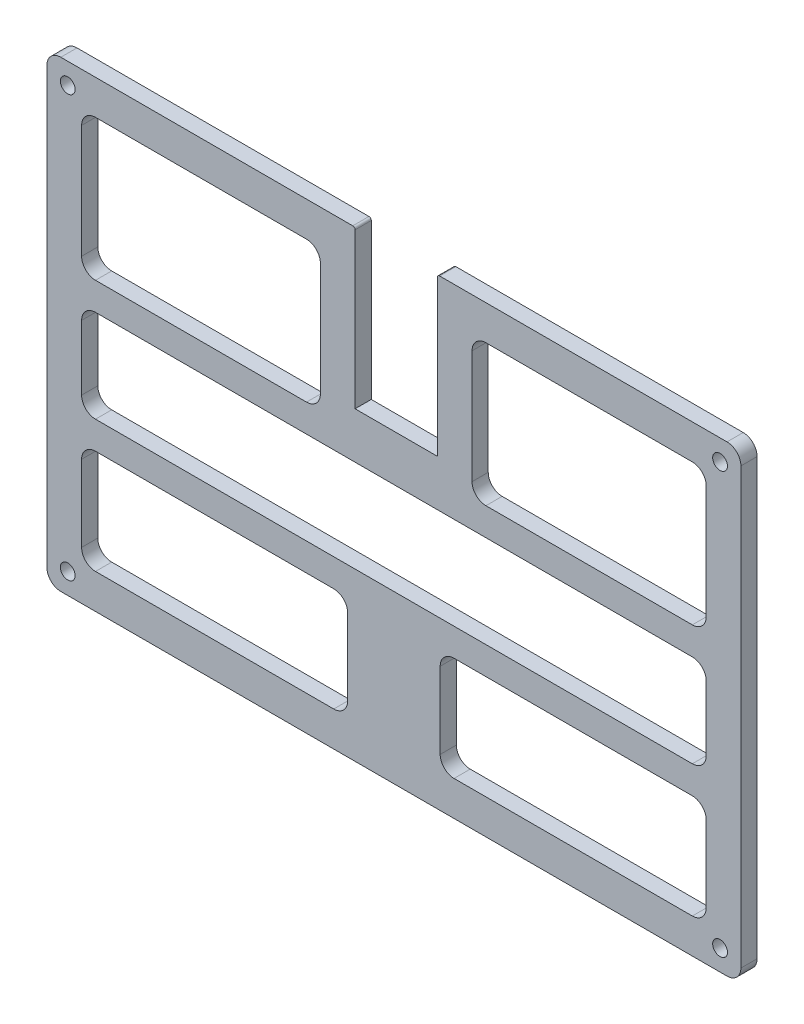
from build123d import *

# Parameters (mm, degrees)
MODEL_R         = 1.59999954
EXTRUDE_1_DEPTH = 3.5
SKETCH_2_W      = 135.00000272
SKETCH_2_H      = 6
EXTRUDE_2_DEPTH = 3.5
FILLET_2_R      = 3
FILLET_3_R      = 3
FILLET_4_R      = 3
FILLET_5_R      = 3
FILLET_6_R      = 3
FILLET_7_R      = 3
FILLET_8_R      = 3
FILLET_9_R      = 3
FILLET_10_R     = 3
FILLET_11_R     = 3
FILLET_12_DEPTH = 3.5
FILLET_13_R     = 3
FILLET_14_R     = 3
FILLET_15_DEPTH = 3.5
FILLET_16_R     = 3
FILLET_17_R     = 3
SHELL_5_DEPTH   = 1.55


with BuildPart() as part:
    # Model → 凸台-拉伸1 (new body)
    with BuildSketch(Plane.XY):
        with BuildLine():
            Line((84.889976, 100), (147.00000318, 100))
            ThreePointArc((147.00000318, 100), (149.121322873, 99.121320613), (150.00000226, 97.00000092))
            Line((150.00000226, 97.00000092), (150.00000226, 3.00000162))
            ThreePointArc((150.00000226, 3.00000162), (149.121322873, 0.878681927), (147.00000318, 2.54e-06))
            Line((147.00000318, 2.54e-06), (2.99999908, 2.54e-06))
            ThreePointArc((2.99999908, 2.54e-06), (0.878679387, 0.878681927), (0, 3.00000162))
            Line((0, 3.00000162), (0, 97.00000092))
            ThreePointArc((0, 97.00000092), (0.878679387, 99.121320613), (2.99999908, 100))
            Line((2.99999908, 100), (66.109976, 100))
            ThreePointArc((66.109976, 100), (66.463529391, 99.853553391), (66.609976, 99.5))
            Line((66.609976, 99.5), (66.609976, 66))
            Line((66.609976, 66), (84.389976, 66))
            Line((84.389976, 66), (84.389976, 99.5))
            ThreePointArc((84.389976, 99.5), (84.536422609, 99.853553391), (84.889976, 100))
        make_face()
        with Locations((4.49999862, 95.50000204)):
            Circle(MODEL_R, mode=Mode.SUBTRACT)
        with Locations((145.5000138, 95.50001474)):
            Circle(MODEL_R, mode=Mode.SUBTRACT)
        with Locations((145.5000138, 4.49999608)):
            Circle(MODEL_R, mode=Mode.SUBTRACT)
        with Locations((4.49999354, 4.49999608)):
            Circle(MODEL_R, mode=Mode.SUBTRACT)
        with BuildLine():
            Line((59.609976, 58.5), (91.389976, 58.5))
            ThreePointArc((91.389976, 58.5), (91.743529391, 58.646446609), (91.889976, 59))
            Line((91.889976, 59), (91.889976, 92.00000066))
            ThreePointArc((91.889976, 92.00000066), (92.036422609, 92.353554051), (92.389976, 92.50000066))
            Line((92.389976, 92.50000066), (139.50000364, 92.50000066))
            ThreePointArc((139.50000364, 92.50000066), (141.621323333, 91.621321273), (142.50000272, 89.50000158))
            Line((142.50000272, 89.50000158), (142.50000272, 10.49999608))
            ThreePointArc((142.50000272, 10.49999608), (141.621323333, 8.378676387), (139.50000364, 7.499997))
            Line((139.50000364, 7.499997), (10.49999908, 7.499997))
            ThreePointArc((10.49999908, 7.499997), (8.378679387, 8.378676387), (7.5, 10.49999608))
            Line((7.5, 10.49999608), (7.5, 89.50000158))
            ThreePointArc((7.5, 89.50000158), (8.378679387, 91.621321273), (10.49999908, 92.50000066))
            Line((10.49999908, 92.50000066), (58.609976, 92.50000066))
            ThreePointArc((58.609976, 92.50000066), (58.963529391, 92.353554051), (59.109976, 92.00000066))
            Line((59.109976, 92.00000066), (59.109976, 59))
            ThreePointArc((59.109976, 59), (59.256422609, 58.646446609), (59.609976, 58.5))
        make_face(mode=Mode.SUBTRACT)
    extrude(amount=EXTRUDE_1_DEPTH)

    # 草图2 → 凸台-拉伸2 (add)
    with BuildSketch(Plane(origin=(0, 0, 0), x_dir=(-1, 0, 0), z_dir=(0, 0, -1))):
        with Locations((-75.00000136, 58.9994)):
            Rectangle(SKETCH_2_W, SKETCH_2_H)
        Polygon((-7.5, 30.00002482), (-65.0000272, 30.00002482), (-65.0000272, 7.499997), (-71.0000272, 7.499997), (-79.0000068, 7.499997), (-85.0000068, 7.499997), (-85.0000068, 30.00002482), (-142.50000272, 30.00002482), (-142.50000272, 36), (-7.5, 36), align=None)
    extrude(amount=-EXTRUDE_2_DEPTH)

    # 圆角2
    fillet_2_edges = [part.edges().sort_by_distance(p)[0] for p in [
        (142.50000272, 30.00002482, 1.75),
    ]]
    fillet(fillet_2_edges, radius=FILLET_2_R)

    # 圆角3
    fillet_3_edges = [part.edges().sort_by_distance(p)[0] for p in [
        (85.0000068, 30.00002482, 1.75),
    ]]
    fillet(fillet_3_edges, radius=FILLET_3_R)

    # 圆角4
    fillet_4_edges = [part.edges().sort_by_distance(p)[0] for p in [
        (85.0000068, 7.499997, 1.75),
    ]]
    fillet(fillet_4_edges, radius=FILLET_4_R)

    # 圆角5
    fillet_5_edges = [part.edges().sort_by_distance(p)[0] for p in [
        (65.0000272, 30.00002482, 1.75),
    ]]
    fillet(fillet_5_edges, radius=FILLET_5_R)

    # 圆角6
    fillet_6_edges = [part.edges().sort_by_distance(p)[0] for p in [
        (7.5, 30.00002482, 1.75),
    ]]
    fillet(fillet_6_edges, radius=FILLET_6_R)

    # 圆角7
    fillet_7_edges = [part.edges().sort_by_distance(p)[0] for p in [
        (65.0000272, 7.499997, 1.75),
    ]]
    fillet(fillet_7_edges, radius=FILLET_7_R)

    # 圆角8
    fillet_8_edges = [part.edges().sort_by_distance(p)[0] for p in [
        (7.5, 55.9994, 1.75),
    ]]
    fillet(fillet_8_edges, radius=FILLET_8_R)

    # 圆角9
    fillet_9_edges = [part.edges().sort_by_distance(p)[0] for p in [
        (7.5, 36, 1.75),
    ]]
    fillet(fillet_9_edges, radius=FILLET_9_R)

    # 圆角10
    fillet_10_edges = [part.edges().sort_by_distance(p)[0] for p in [
        (142.50000272, 55.9994, 1.75),
    ]]
    fillet(fillet_10_edges, radius=FILLET_10_R)

    # 圆角11
    fillet_11_edges = [part.edges().sort_by_distance(p)[0] for p in [
        (142.50000272, 36, 1.75),
    ]]
    fillet(fillet_11_edges, radius=FILLET_11_R)

    # 圆角12: read off the stored shape, not the designer's step
    # 圆角12 outline → 圆角12 (add)
    with BuildSketch(Plane.XY):
        with BuildLine():
            ThreePointArc((56.109976, 92.50000066), (58.231296344, 91.621321004), (59.109976, 89.50000066))
            Line((59.109976, 89.50000066), (59.109976, 92.00000066))
            ThreePointArc((59.109976, 92.00000066), (58.963529391, 92.353554051), (58.609976, 92.50000066))
            Line((58.609976, 92.50000066), (56.109976, 92.50000066))
        make_face()
    extrude(amount=FILLET_12_DEPTH)

    # 圆角13
    fillet_13_edges = [part.edges().sort_by_distance(p)[0] for p in [
        (7.5, 61.9994, 1.75),
    ]]
    fillet(fillet_13_edges, radius=FILLET_13_R)

    # 圆角14
    fillet_14_edges = [part.edges().sort_by_distance(p)[0] for p in [
        (59.109976, 61.9994, 1.75),
    ]]
    fillet(fillet_14_edges, radius=FILLET_14_R)

    # 圆角15: read off the stored shape, not the designer's step
    # 圆角15 outline → 圆角15 (add)
    with BuildSketch(Plane.XY):
        with BuildLine():
            ThreePointArc((91.889976, 89.50000066), (92.768655656, 91.621321004), (94.889976, 92.50000066))
            Line((94.889976, 92.50000066), (92.389976, 92.50000066))
            ThreePointArc((92.389976, 92.50000066), (92.036422609, 92.353554051), (91.889976, 92.00000066))
            Line((91.889976, 92.00000066), (91.889976, 89.50000066))
        make_face()
    extrude(amount=FILLET_15_DEPTH)

    # 圆角16
    fillet_16_edges = [part.edges().sort_by_distance(p)[0] for p in [
        (91.889976, 61.9994, 1.75),
    ]]
    fillet(fillet_16_edges, radius=FILLET_16_R)

    # 圆角17
    fillet_17_edges = [part.edges().sort_by_distance(p)[0] for p in [
        (142.50000272, 61.9994, 1.75),
    ]]
    fillet(fillet_17_edges, radius=FILLET_17_R)

    # 抽壳5: read off the stored shape, not the designer's step
    # 抽壳5 outline → 抽壳5 (cut)
    with BuildSketch(Plane.XY):
        with BuildLine():
            Line((148.05000226, 6.96982514), (148.05000226, 93.03018568))
            ThreePointArc((148.05000226, 93.03018568), (145.651621189, 91.953253974), (143.170088948, 92.821592272))
            ThreePointArc((143.170088948, 92.821592272), (144.118954267, 91.279829099), (144.45000272, 89.50000158))
            Line((144.45000272, 89.50000158), (144.45000272, 64.9994))
            ThreePointArc((144.45000272, 64.9994), (143.000181287, 61.499221433), (139.50000272, 60.0494))
            Line((139.50000272, 60.0494), (94.889976, 60.0494))
            ThreePointArc((94.889976, 60.0494), (91.389797433, 61.499221433), (89.939976, 64.9994))
            Line((89.939976, 64.9994), (89.939976, 89.50000066))
            ThreePointArc((89.939976, 89.50000066), (91.389797433, 93.000179227), (94.889976, 94.45000066))
            Line((94.889976, 94.45000066), (139.50000364, 94.45000066))
            ThreePointArc((139.50000364, 94.45000066), (141.279830004, 94.118952652), (142.821592497, 93.170088549))
            ThreePointArc((142.821592497, 93.170088549), (141.953252898, 95.651618945), (143.030181436, 98.05))
            Line((143.030181436, 98.05), (86.339976, 98.05))
            Line((86.339976, 98.05), (86.339976, 64.05))
            Line((86.339976, 64.05), (64.659976, 64.05))
            Line((64.659976, 64.05), (64.659976, 98.05))
            Line((64.659976, 98.05), (6.969817872, 98.05))
            ThreePointArc((6.969817872, 98.05), (8.046756275, 95.651682201), (7.178507736, 93.170176799))
            ThreePointArc((7.178507736, 93.170176799), (8.720234077, 94.118976296), (10.49999908, 94.45000066))
            Line((10.49999908, 94.45000066), (56.109976, 94.45000066))
            ThreePointArc((56.109976, 94.45000066), (59.610154567, 93.000179227), (61.059976, 89.50000066))
            Line((61.059976, 89.50000066), (61.059976, 64.9994))
            ThreePointArc((61.059976, 64.9994), (59.610154567, 61.499221433), (56.109976, 60.0494))
            Line((56.109976, 60.0494), (10.5, 60.0494))
            ThreePointArc((10.5, 60.0494), (6.999821433, 61.499221433), (5.55, 64.9994))
            Line((5.55, 64.9994), (5.55, 89.50000158))
            ThreePointArc((5.55, 89.50000158), (5.881024364, 91.279766583), (6.829823861, 92.821492924))
            ThreePointArc((6.829823861, 92.821492924), (4.348317985, 91.953244405), (1.95, 93.030183469))
            Line((1.95, 93.030183469), (1.95, 6.969819896))
            ThreePointArc((1.95, 6.969819896), (4.348331062, 8.046754491), (6.829840696, 7.178486133))
            ThreePointArc((6.829840696, 7.178486133), (5.881028875, 8.720219371), (5.55, 10.49999608))
            Line((5.55, 10.49999608), (5.55, 27.00002482))
            ThreePointArc((5.55, 27.00002482), (6.999821433, 30.500203387), (10.5, 31.95002482))
            Line((10.5, 31.95002482), (62.0000272, 31.95002482))
            ThreePointArc((62.0000272, 31.95002482), (65.500205767, 30.500203387), (66.9500272, 27.00002482))
            Line((66.9500272, 27.00002482), (66.9500272, 10.499997))
            ThreePointArc((66.9500272, 10.499997), (65.500205767, 6.999818433), (62.0000272, 5.549997))
            Line((62.0000272, 5.549997), (10.49999908, 5.549997))
            ThreePointArc((10.49999908, 5.549997), (8.720220238, 5.881026696), (7.178485744, 6.829840763))
            ThreePointArc((7.178485744, 6.829840763), (8.046751881, 4.348331965), (6.969817356, 1.95000254))
            Line((6.969817356, 1.95000254), (143.030189984, 1.95000254))
            ThreePointArc((143.030189984, 1.95000254), (141.953254903, 4.348344975), (142.821538688, 6.829860413))
            ThreePointArc((142.821538688, 6.829860413), (141.279796144, 5.881031961), (139.50000364, 5.549997))
            Line((139.50000364, 5.549997), (88.0000068, 5.549997))
            ThreePointArc((88.0000068, 5.549997), (84.499828233, 6.999818433), (83.0500068, 10.499997))
            Line((83.0500068, 10.499997), (83.0500068, 27.00002482))
            ThreePointArc((83.0500068, 27.00002482), (84.499828233, 30.500203387), (88.0000068, 31.95002482))
            Line((88.0000068, 31.95002482), (139.50000272, 31.95002482))
            ThreePointArc((139.50000272, 31.95002482), (143.000181287, 30.500203387), (144.45000272, 27.00002482))
            Line((144.45000272, 27.00002482), (144.45000272, 10.49999608))
            ThreePointArc((144.45000272, 10.49999608), (144.118969266, 8.720207487), (143.170144932, 7.178467247))
            ThreePointArc((143.170144932, 7.178467247), (145.651658255, 8.046755262), (148.05000226, 6.96982514))
        make_face()
        with BuildLine():
            Line((144.45000272, 52.9994), (144.45000272, 39))
            ThreePointArc((144.45000272, 39), (143.000181287, 35.499821433), (139.50000272, 34.05))
            Line((139.50000272, 34.05), (10.5, 34.05))
            ThreePointArc((10.5, 34.05), (6.999821433, 35.499821433), (5.55, 39))
            Line((5.55, 39), (5.55, 52.9994))
            ThreePointArc((5.55, 52.9994), (6.999821433, 56.499578567), (10.5, 57.9494))
            Line((10.5, 57.9494), (139.50000272, 57.9494))
            ThreePointArc((139.50000272, 57.9494), (143.000181287, 56.499578567), (144.45000272, 52.9994))
        make_face(mode=Mode.SUBTRACT)
    extrude(amount=SHELL_5_DEPTH, mode=Mode.SUBTRACT)


solid = part.part
